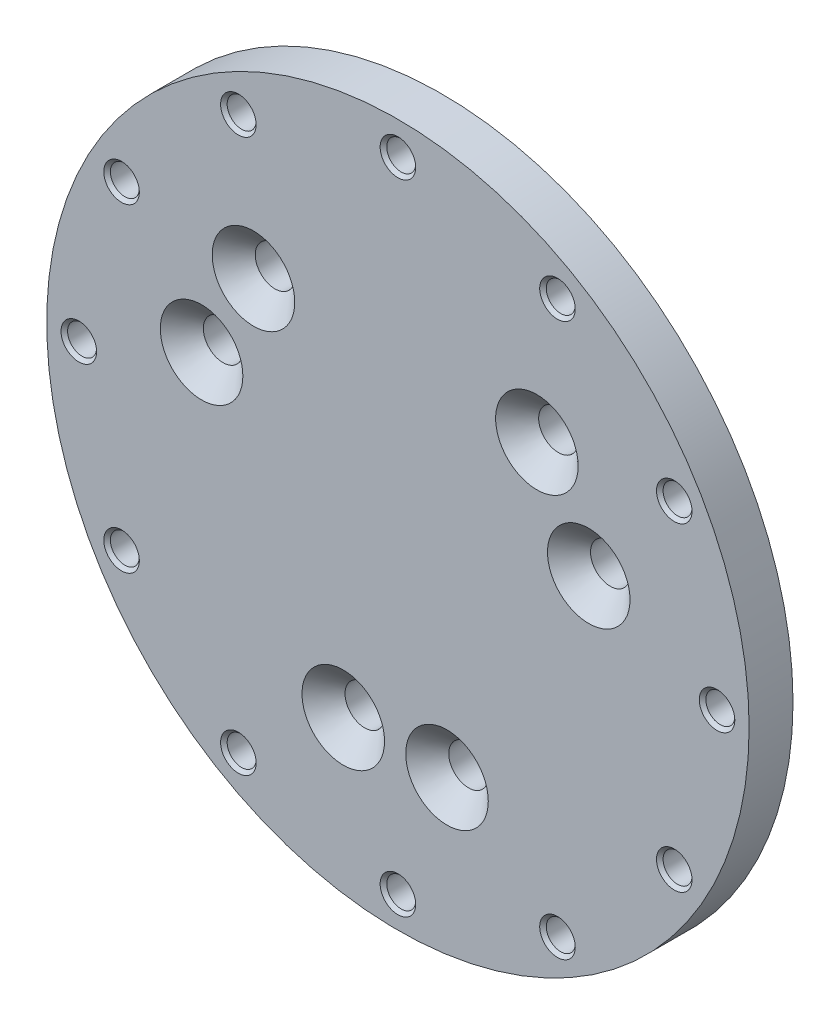
from build123d import *

# Parameters (mm, degrees)
SKETCH1_R                                       = 27.5
BOSS_EXTRUDE1_DEPTH                             = 4
SKETCH2_R                                       = 40
BOSS_EXTRUDE2_DEPTH                             = 5
CIRPATTERN1_COUNT                               = 12
CSK_FOR_M4_FLAT_HEAD_MACHINE_SCREW2_D           = 4.5
CSK_FOR_M4_FLAT_HEAD_MACHINE_SCREW2_CSINK_D     = 9.4
CSK_FOR_M4_FLAT_HEAD_MACHINE_SCREW2_CSINK_ANGLE = 90
CIRPATTERN3_COUNT                               = 12
FILLET2_R                                       = 10


with BuildPart() as part:
    # Sketch1 → Boss-Extrude1 (new, symmetric)
    with BuildSketch(Plane.XY):
        Circle(SKETCH1_R)
    extrude(amount=BOSS_EXTRUDE1_DEPTH, both=True)

    # Sketch2 → Boss-Extrude2 (add)
    with BuildSketch(Plane.XY.offset(4)):
        Circle(SKETCH2_R)
    extrude(amount=BOSS_EXTRUDE2_DEPTH)

    # Sketch5 → M4x0.7 Tapped Hole1 (revolve, cut)
    with BuildSketch(Plane(origin=(0, 36.25, 9), x_dir=(0, -1, 0), z_dir=(1, 0, 0))):
        Polygon((0, 0), (0, 11.091420021), (1.65, 10.1), (1.65, 0.375), (2.025, 0), align=None)
    m4x0_7_tapped_hole1 = revolve(axis=Axis((0, 36.25, 15.35), (0, 0, -1)), mode=Mode.SUBTRACT)

    # CirPattern1: M4x0.7 Tapped Hole1 ×12 about axis
    cirpattern1_axis = Axis((0, -0.093143502, 0), (0, 0, 1))
    for i in range(1, CIRPATTERN1_COUNT):
        add(m4x0_7_tapped_hole1.rotate(cirpattern1_axis, i * 360 / CIRPATTERN1_COUNT), mode=Mode.SUBTRACT)

    # CSK for M4 Flat Head Machine Screw2 (through all)
    with Locations(Plane.XY.offset(9)):
        with Locations((21.733331092, 5.823428515)):
            csk_for_m4_flat_head_machine_screw2 = CounterSinkHole(CSK_FOR_M4_FLAT_HEAD_MACHINE_SCREW2_D / 2, CSK_FOR_M4_FLAT_HEAD_MACHINE_SCREW2_CSINK_D / 2, counter_sink_angle=CSK_FOR_M4_FLAT_HEAD_MACHINE_SCREW2_CSINK_ANGLE)

    # CirPattern3: CSK for M4 Flat Head Machine Screw2 ×12 about axis, 6 skipped
    cirpattern3_axis = Axis((-0.314050172, -0.081151288, 0), (0, 0, 1))
    add([csk_for_m4_flat_head_machine_screw2.rotate(cirpattern3_axis, i * 360 / CIRPATTERN3_COUNT) for i in range(1, CIRPATTERN3_COUNT) if i not in (2, 3, 6, 7, 10, 11)], mode=Mode.SUBTRACT)

    # Fillet2
    # the kernel refuses this fillet: 10 mm, written as the material it adds along each edge
    with BuildSketch(Plane(origin=(0, 0, 4), x_dir=(1, 0, 0), z_dir=(0, -1, 0))) as fillet2_piece_1_section:
        with BuildLine():
            CenterArc((37.297958971, -10), FILLET2_R, 90, 78.463040967)
            Line((37.297958971, 0), (37.297958971, 0.2))
            Line((37.297958971, 0.2), (27.5, 0.2))
            Line((27.5, 0.2), (27.3, 0))
            ThreePointArc((27.3, 0), (27.3, -4), (27.304040821, -7.96))
            Line((27.304040821, -7.96), (27.5, -8))
        make_face()
    fillet2_piece_1 = revolve(axis=Axis((0, 0, 4), (0, 0, 1)), mode=Mode.PRIVATE)
    fillet2_piece_1 = fillet2_piece_1 - Plane(origin=(18.171571751, 31.380942024, 1.87223315), x_dir=(-0.5000000000000004, -0.8660254037844384, 0), z_dir=(0, 0, 1)) * Cylinder(1.65, 150, mode=Mode.PRIVATE)
    fillet2_piece_1 = fillet2_piece_1 - Plane(origin=(31.474085526, 18.078428249, 1.87223315), x_dir=(-0.8660254037844386, -0.5000000000000001, 0), z_dir=(0, 0, 1)) * Cylinder(1.65, 150, mode=Mode.PRIVATE)
    fillet2_piece_1 = fillet2_piece_1 - Plane(origin=(36.343143502, -0.093143502, 1.87223315), x_dir=(-1, 0, 0), z_dir=(0, 0, 1)) * Cylinder(1.65, 150, mode=Mode.PRIVATE)
    fillet2_piece_1 = fillet2_piece_1 - Plane(origin=(0, 36.25, 1.87223315), x_dir=(0, -1, 0), z_dir=(0, 0, 1)) * Cylinder(1.65, 150, mode=Mode.PRIVATE)
    fillet2_piece_1 = fillet2_piece_1 - Plane(origin=(-18.171571751, 31.380942024, 1.87223315), x_dir=(0.49999999999999994, -0.8660254037844387, 0), z_dir=(0, 0, 1)) * Cylinder(1.65, 150, mode=Mode.PRIVATE)
    fillet2_piece_1 = fillet2_piece_1 - Plane(origin=(-31.474085526, 18.078428249, 1.87223315), x_dir=(0.8660254037844386, -0.5000000000000001, 0), z_dir=(0, 0, 1)) * Cylinder(1.65, 150, mode=Mode.PRIVATE)
    fillet2_piece_1 = fillet2_piece_1 - Plane(origin=(31.474085526, -18.264715253, 1.87223315), x_dir=(-0.8660254037844384, 0.5000000000000004, 0), z_dir=(0, 0, 1)) * Cylinder(1.65, 150, mode=Mode.PRIVATE)
    fillet2_piece_1 = fillet2_piece_1 - Plane(origin=(18.171571751, -31.567229028, 1.87223315), x_dir=(-0.5000000000000001, 0.8660254037844386, 0), z_dir=(0, 0, 1)) * Cylinder(1.65, 150, mode=Mode.PRIVATE)
    fillet2_piece_1 = fillet2_piece_1 - Plane(origin=(0, -36.436287004, 1.87223315), x_dir=(0, 1, 0), z_dir=(0, 0, 1)) * Cylinder(1.65, 150, mode=Mode.PRIVATE)
    fillet2_piece_1 = fillet2_piece_1 - Plane(origin=(-36.343143502, -0.093143502, 1.87223315), x_dir=(1, 0, 0), z_dir=(0, 0, 1)) * Cylinder(1.65, 150, mode=Mode.PRIVATE)
    fillet2_piece_1 = fillet2_piece_1 - Plane(origin=(-31.474085526, -18.264715253, 1.87223315), x_dir=(0.8660254037844388, 0.49999999999999983, 0), z_dir=(0, 0, 1)) * Cylinder(1.65, 150, mode=Mode.PRIVATE)
    fillet2_piece_1 = fillet2_piece_1 - Plane(origin=(-18.171571751, -31.567229028, 1.87223315), x_dir=(0.49999999999999994, 0.8660254037844388, 0), z_dir=(0, 0, 1)) * Cylinder(1.65, 150, mode=Mode.PRIVATE)
    add(fillet2_piece_1)


solid = part.part
